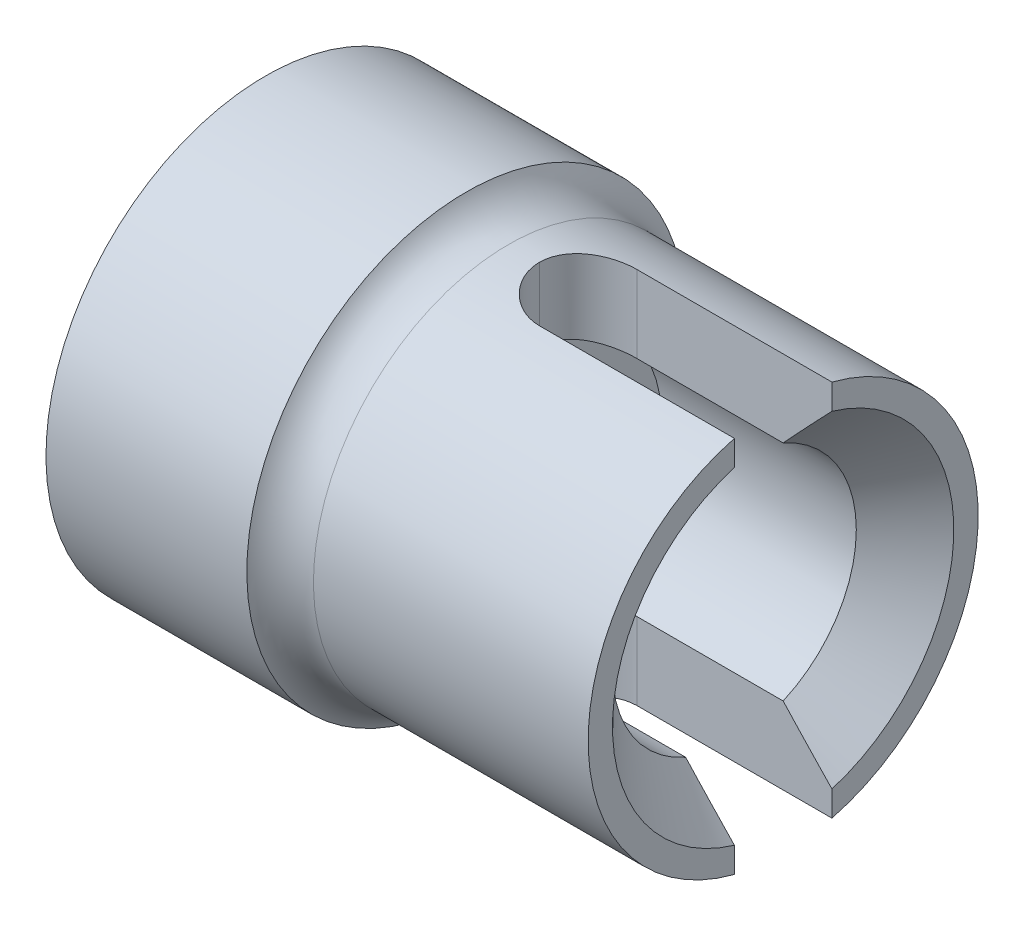
from build123d import *

# Parameters (mm, degrees)
SKETCH1_W               = 25.4
SKETCH1_H               = 3.175
SKETCH1_W_2             = 1.5875
SKETCH1_H_2             = 1.5875
SKETCH1_W_3             = 7.9375
SKETCH1_H_3             = 2.38125
CUT_EXTRUDE1_DEPTH      = 27.940768363
CUT_EXTRUDE1_DEPTH_BACK = 27.940768363
SKETCH2_W               = 0.79375
SKETCH2_H               = 3.175
SKETCH2_R               = 1.5875
FILLET1_R               = 1.5875
CHAMFER1_SIZE           = 1.5875
CUT_EXTRUDE2_DEPTH      = 27.94076841
SKETCH3_3_R             = 2.286
CUT_EXTRUDE3_DEPTH      = 14.67923997
SKETCH3_4_R             = 7.14375
BOSS_EXTRUDE1_DEPTH     = 6.5405
FILLET2_R               = 1.5875


# Some blends are built 0.0001 mm under size
with BuildPart() as part:
    # Sketch1 → Revolve1 (revolve)
    with BuildSketch(Plane.XY):
        with Locations((-12.7, 1.5875)):
            Rectangle(SKETCH1_W, SKETCH1_H)
        with Locations((-0.79375, 3.96875)):
            Rectangle(SKETCH1_W_2, SKETCH1_H_2)
        Polygon((0, 3.175), (0, 0), (2.38125, 0), (2.38125, 3.96875), (2.38125, 6.35), (0, 6.35), (0, 4.7625), align=None)
        with Locations((6.35, 5.159375)):
            Rectangle(SKETCH1_W_3, SKETCH1_H_3)
    revolve(axis=Axis((0, 0, 0), (-1, 0, 0)))

    # Sketch2 → Cut-Extrude1 (cut, two sides: drawn at the far end of the back side and taken through both)
    with BuildSketch(Plane(origin=(0, 0, 0), x_dir=(1, 0, 0), z_dir=(0, 1, 0)).offset(-CUT_EXTRUDE1_DEPTH_BACK)):
        with Locations((2.778125, 0)):
            Rectangle(SKETCH2_W, SKETCH2_H)
        with BuildLine():
            Line((3.175, -1.5875), (6.35, -1.5875))
            ThreePointArc((6.35, -1.5875), (4.7625, 0), (6.35, 1.5875))
            Line((6.35, 1.5875), (3.175, 1.5875))
            Line((3.175, 1.5875), (3.175, -1.5875))
        make_face()
        with Locations((6.35, 0)):
            Circle(SKETCH2_R)
        with BuildLine():
            Line((6.35, -1.5875), (10.31875, -1.5875))
            Line((10.31875, -1.5875), (10.31875, 1.5875))
            Line((10.31875, 1.5875), (6.35, 1.5875))
            ThreePointArc((6.35, 1.5875), (7.472532015, 1.122532015), (7.9375, 0))
            ThreePointArc((7.9375, 0), (7.472532015, -1.122532015), (6.35, -1.5875))
        make_face()
    extrude(amount=CUT_EXTRUDE1_DEPTH + CUT_EXTRUDE1_DEPTH_BACK, mode=Mode.SUBTRACT)

    # Fillet1
    fillet1_edges = [part.edges().sort_by_distance(p)[0] for p in [
        (2.38125, -4.89289026, -1.5875),
        (2.38125, 4.89289026, -1.5875),
        (2.38125, -4.89289026, 1.5875),
        (2.38125, 4.89289026, 1.5875),
    ]]
    fillet(fillet1_edges, radius=FILLET1_R - 0.0001)  # a hair under: the kernel refuses the full size

    # Chamfer1
    chamfer1_edges = [part.edges().sort_by_distance(p)[0] for p in [
        (10.31875, 0, 3.96875),
        (10.31875, 0, -3.96875),
    ]]
    chamfer(chamfer1_edges, length=CHAMFER1_SIZE)

    # Sketch3 → Cut-Extrude2 (cut, through all)
    with BuildSketch(Plane.ZY):
        with BuildLine():
            Line((-5.034429311, 5.567612646), (-7.338908645, 1.576137354))
            ThreePointArc((-7.338908645, 1.576137354), (-7.50625, 0), (-7.338908645, -1.576137354))
            Line((-7.338908645, -1.576137354), (-5.034429311, -5.567612646))
            ThreePointArc((-5.034429311, -5.567612646), (-3.753125, -6.500603187), (-2.304479334, -7.14375))
            Line((-2.304479334, -7.14375), (2.304479334, -7.14375))
            ThreePointArc((2.304479334, -7.14375), (3.753125, -6.500603187), (5.034429311, -5.567612646))
            Line((5.034429311, -5.567612646), (7.338908645, -1.576137354))
            ThreePointArc((7.338908645, -1.576137354), (7.50625, 0), (7.338908645, 1.576137354))
            Line((7.338908645, 1.576137354), (5.034429311, 5.567612646))
            ThreePointArc((5.034429311, 5.567612646), (3.753125, 6.500603187), (2.304479334, 7.14375))
            Line((2.304479334, 7.14375), (-2.304479334, 7.14375))
            ThreePointArc((-2.304479334, 7.14375), (-3.753125, 6.500603187), (-5.034429311, 5.567612646))
        make_face()
    extrude(amount=CUT_EXTRUDE2_DEPTH, mode=Mode.SUBTRACT)

    # Sketch3<3> → Cut-Extrude3 (cut, through all)
    with BuildSketch(Plane.ZY):
        with Locations(Location((0, 0, 0), (0, 0, 270))):
            Circle(SKETCH3_3_R)
    extrude(amount=-CUT_EXTRUDE3_DEPTH, mode=Mode.SUBTRACT)

    # Sketch3<4> → Boss-Extrude1 (add)
    with BuildSketch(Plane.ZY):
        with Locations(Location((0, 0, 0), (0, 0, 270))):
            Circle(SKETCH3_4_R)
        with BuildLine():
            Line((3.177844334, -4.020812156), (5.071047637, -0.741687844))
            ThreePointArc((5.071047637, -0.741687844), (5.125, 0), (5.071047637, 0.741687844))
            Line((5.071047637, 0.741687844), (3.177844334, 4.020812156))
            ThreePointArc((3.177844334, 4.020812156), (2.5625, 4.438380194), (1.893203304, 4.7625))
            Line((1.893203304, 4.7625), (-1.893203304, 4.7625))
            ThreePointArc((-1.893203304, 4.7625), (-2.5625, 4.438380194), (-3.177844334, 4.020812156))
            Line((-3.177844334, 4.020812156), (-5.071047637, 0.741687844))
            ThreePointArc((-5.071047637, 0.741687844), (-5.125, 0), (-5.071047637, -0.741687844))
            Line((-5.071047637, -0.741687844), (-3.177844334, -4.020812156))
            ThreePointArc((-3.177844334, -4.020812156), (-2.5625, -4.438380194), (-1.893203304, -4.7625))
            Line((-1.893203304, -4.7625), (1.893203304, -4.7625))
            ThreePointArc((1.893203304, -4.7625), (2.5625, -4.438380194), (3.177844334, -4.020812156))
        make_face(mode=Mode.SUBTRACT)
    extrude(amount=BOSS_EXTRUDE1_DEPTH)

    # Fillet2
    # the kernel refuses this fillet: 1.5875 mm, written as the material it adds along each edge
    with BuildSketch(Plane(origin=(0, 0, 0), x_dir=(0, 1, 0), z_dir=(0, 0, 1))) as fillet2_piece_1:
        with BuildLine():
            CenterArc((7.9375, -1.374815329), FILLET2_R, 120, 60)
            Line((7.14375, 0), (7.127875, 0.027496307))
            ThreePointArc((7.127875, 0.027496307), (6.746875, 0.03175), (6.35, 0.03175))
            Line((6.35, 0.03175), (6.31825, 0))
            Line((6.31825, 0), (6.31825, -1.374815329))
            Line((6.31825, -1.374815329), (6.35, -1.374815329))
        make_face()
    revolve(axis=Axis((0, 0, 0), (-1, 0, 0)))


solid = part.part
